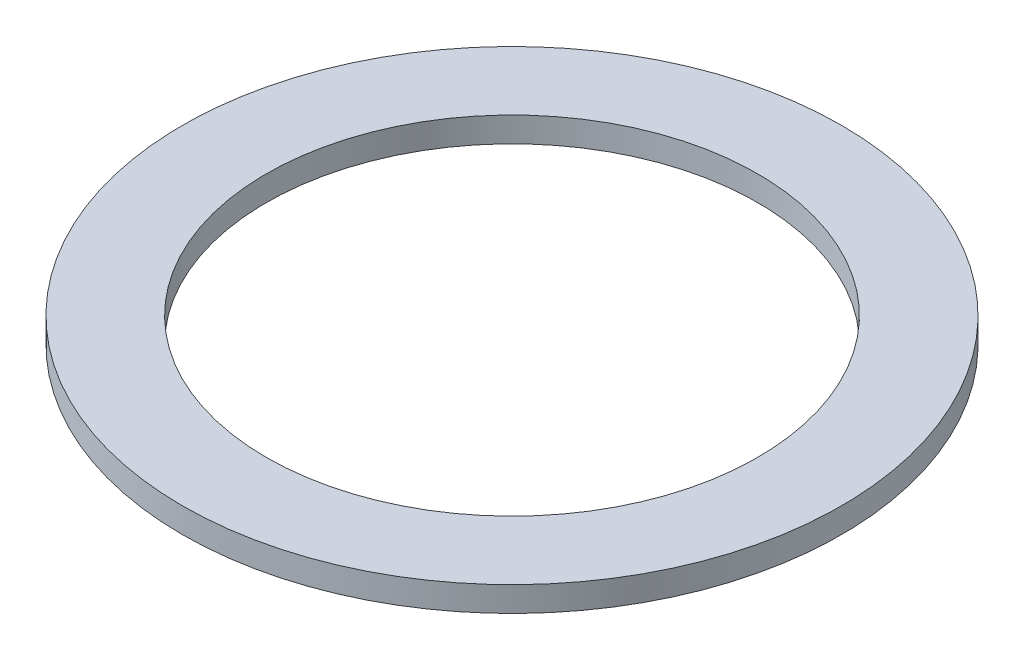
from build123d import *

# Parameters (mm, degrees)
SKETCH1_R           = 66
SKETCH1_R_2         = 49.2
BOSS_EXTRUDE1_DEPTH = 5


with BuildPart() as part:
    # Sketch1 → Boss-Extrude1 (new body)
    with BuildSketch(Plane(origin=(0, 0, 0), x_dir=(1, 0, 0), z_dir=(0, 1, 0))):
        Circle(SKETCH1_R)
        Circle(SKETCH1_R_2, mode=Mode.SUBTRACT)
    extrude(amount=BOSS_EXTRUDE1_DEPTH)


solid = part.part
